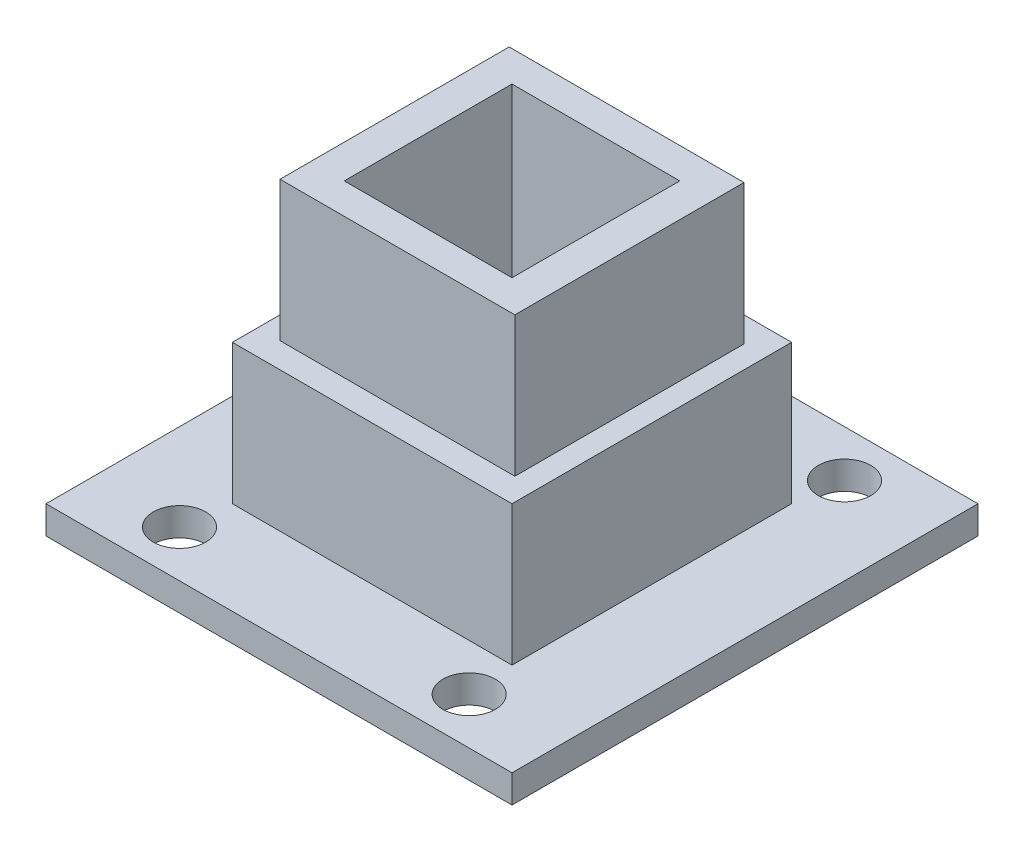
from build123d import *

# Parameters (mm, degrees)
CROQUIS1_W              = 50
CROQUIS1_H              = 50
SALIENTE_EXTRUIR1_DEPTH = 3
CROQUIS2_W              = 30
CROQUIS2_H              = 30
CROQUIS2_W_2            = 18
CROQUIS2_H_2            = 18
SALIENTE_EXTRUIR2_DEPTH = 30
CROQUIS3_R              = 2.813865728
CORTAR_EXTRUIR1_DEPTH   = 10
CROQUIS4_W              = 30
CROQUIS4_H              = 30
CROQUIS4_W_2            = 25.2
CROQUIS4_H_2            = 24.586322286
CORTAR_EXTRUIR2_DEPTH   = 15


with BuildPart() as part:
    # Croquis1 → Saliente-Extruir1 (new body)
    with BuildSketch(Plane(origin=(0, 0, 0), x_dir=(1, 0, 0), z_dir=(0, 1, 0))):
        Rectangle(CROQUIS1_W, CROQUIS1_H)
    extrude(amount=SALIENTE_EXTRUIR1_DEPTH)

    # Croquis2 → Saliente-Extruir2 (add)
    with BuildSketch(Plane(origin=(0, 3, 0), x_dir=(1, 0, 0), z_dir=(0, 1, 0))):
        Rectangle(CROQUIS2_W, CROQUIS2_H)
        Rectangle(CROQUIS2_W_2, CROQUIS2_H_2, mode=Mode.SUBTRACT)
    extrude(amount=SALIENTE_EXTRUIR2_DEPTH)

    # Croquis3 → Cortar-Extruir1 (cut)
    with BuildSketch(Plane(origin=(0, 3, 0), x_dir=(1, 0, 0), z_dir=(0, 1, 0))):
        with Locations((15.405421421, -20)):
            Circle(CROQUIS3_R)
        with Locations((-15.676153635, -20)):
            Circle(CROQUIS3_R)
        with Locations((15.676153635, 20)):
            Circle(CROQUIS3_R)
        with Locations((-15.676153635, 20)):
            Circle(CROQUIS3_R)
    extrude(amount=-CORTAR_EXTRUIR1_DEPTH, mode=Mode.SUBTRACT)

    # Croquis4 → Cortar-Extruir2 (cut)
    with BuildSketch(Plane(origin=(0, 33, 0), x_dir=(1, 0, 0), z_dir=(0, 1, 0))):
        Rectangle(CROQUIS4_W, CROQUIS4_H)
        Rectangle(CROQUIS4_W_2, CROQUIS4_H_2, mode=Mode.SUBTRACT)
    extrude(amount=-CORTAR_EXTRUIR2_DEPTH, mode=Mode.SUBTRACT)


solid = part.part
